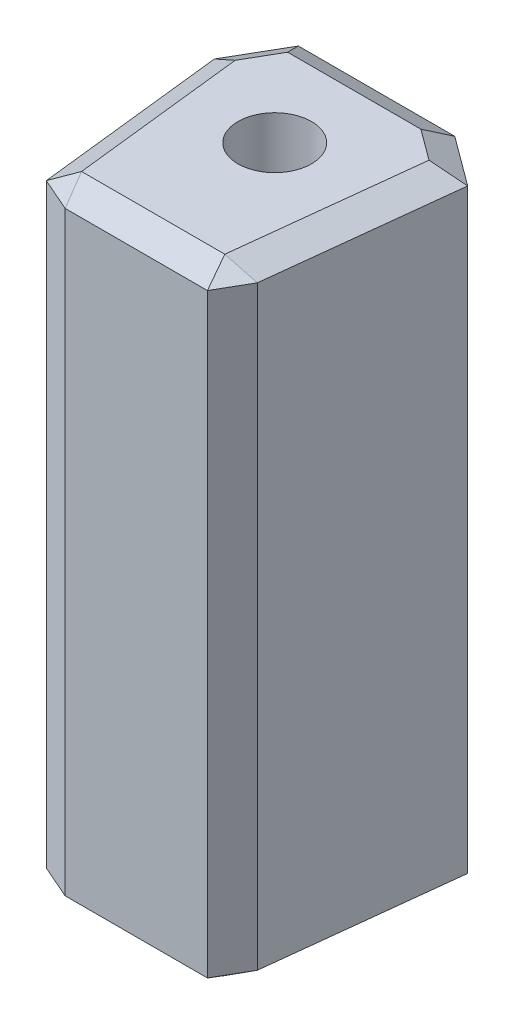
from build123d import *
from OCP.BRepFilletAPI import BRepFilletAPI_MakeChamfer

# Parameters (mm, degrees)
SKETCH1_R           = 3.175
BOSS_EXTRUDE1_DEPTH = 53.975
CHAMFER1_SIZE       = 3.175
CHAMFER1_SIZE2      = 4.631063529
CHAMFER2_SIZE       = 1.27
CHAMFER2_SIZE2      = 2.749716278
CHAMFER2_SIZE2_2    = 2.199704526


# Read off the part's stored shape, not the designer's step: Imported1
with BuildPart() as part:
    # Sketch1 → Boss-Extrude1 (new body)
    with BuildSketch(Plane(origin=(0, -26.9875, 0), x_dir=(-1, 0, 0), z_dir=(0, -1, 0))):
        Polygon((-8.155551794, -74.05198332), (8.155551794, -74.05198332), (10.657362253, -51.82698332), (-10.657362253, -51.82698332), align=None)
        with Locations(Location((0, -61.35198332, 0), (0, 0, 270))):
            Circle(SKETCH1_R, mode=Mode.SUBTRACT)
    extrude(amount=-BOSS_EXTRUDE1_DEPTH)

    # Chamfer1: one chamfer whose edges measure the first distance from different faces: ONE call of the kernel's chamfer builder (chamfer() names one face for all edges)
    chamfer1_edges_1 = [part.edges().sort_by_distance(p)[0] for p in [
        (-10.657362253, 0, 51.82698332),
    ]]
    chamfer1_side_1 = [part.faces().sort_by_distance(p)[0] for p in [
        (0, 0, 51.82698332),
    ]]
    chamfer1_edges_2 = [part.edges().sort_by_distance(p)[0] for p in [
        (10.657362253, 0, 51.82698332),
    ]]
    chamfer1_side_2 = [part.faces().sort_by_distance(p)[0] for p in [
        (9.406457023, 0, 62.93948332),
    ]]
    chamfer1 = BRepFilletAPI_MakeChamfer(part.part.solid().wrapped)
    for e in chamfer1_edges_1:
        chamfer1.Add(CHAMFER1_SIZE, CHAMFER1_SIZE2, e.wrapped, chamfer1_side_1[0].wrapped)  # the first distance lies on this face
    for e in chamfer1_edges_2:
        chamfer1.Add(CHAMFER1_SIZE, CHAMFER1_SIZE2, e.wrapped, chamfer1_side_2[0].wrapped)  # the first distance lies on this face
    add(Compound.cast(chamfer1.Shape()), mode=Mode.REPLACE)

    # Chamfer2: one chamfer whose edges measure the first distance from different faces: ONE call of the kernel's chamfer builder (chamfer() names one face for all edges)
    chamfer2_edges_1 = [part.edges().sort_by_distance(p)[0] for p in [
        (8.155551794, 0, 74.05198332),
    ]]
    chamfer2_side_1 = [part.faces().sort_by_distance(p)[0] for p in [
        (0, 0, 74.05198332),
    ]]
    chamfer2_edges_2 = [part.edges().sort_by_distance(p)[0] for p in [
        (-9.147439527, -26.9875, 65.240482514),
        (-9.147439527, 26.9875, 65.240482514),
    ]]
    chamfer2_side_2 = [part.faces().sort_by_distance(p)[0] for p in [
        (-9.147439527, 0, 65.240482514),
    ]]
    chamfer2_edges_3 = [part.edges().sort_by_distance(p)[0] for p in [
        (0, -26.9875, 74.05198332),
        (0, 26.9875, 74.05198332),
    ]]
    chamfer2_side_3 = [part.faces().sort_by_distance(p)[0] for p in [
        (0, 0, 74.05198332),
    ]]
    chamfer2_edges_4 = [part.edges().sort_by_distance(p)[0] for p in [
        (9.228877825, 26.9875, 64.517019969),
        (9.228877825, -26.9875, 64.517019969),
    ]]
    chamfer2_side_4 = [part.faces().sort_by_distance(p)[0] for p in [
        (9.228877825, 0, 64.517019969),
    ]]
    chamfer2_edges_5 = [part.edges().sort_by_distance(p)[0] for p in [
        (-8.155551794, 0, 74.05198332),
    ]]
    chamfer2_side_5 = [part.faces().sort_by_distance(p)[0] for p in [
        (-9.147439527, 0, 65.240482514),
    ]]
    chamfer2_edges_6 = [part.edges().sort_by_distance(p)[0] for p in [
        (-0.728031765, -26.9875, 51.82698332),
        (-0.728031765, 26.9875, 51.82698332),
    ]]
    chamfer2_side_6 = [part.faces().sort_by_distance(p)[0] for p in [
        (-0.728031765, 0, 51.82698332),
    ]]
    chamfer2_edges_7 = [part.edges().sort_by_distance(p)[0] for p in [
        (8.16425129, -26.9875, 53.404519969),
        (8.16425129, 26.9875, 53.404519969),
    ]]
    chamfer2_side_7 = [part.faces().sort_by_distance(p)[0] for p in [
        (8.16425129, 0, 53.404519969),
    ]]
    chamfer2_edges_8 = [part.edges().sort_by_distance(p)[0] for p in [
        (-8.810844757, -26.9875, 54.127982514),
        (-8.810844757, 26.9875, 54.127982514),
    ]]
    chamfer2_side_8 = [part.faces().sort_by_distance(p)[0] for p in [
        (-8.810844757, 0, 54.127982514),
    ]]
    chamfer2 = BRepFilletAPI_MakeChamfer(part.part.solid().wrapped)
    for e in chamfer2_edges_1:
        chamfer2.Add(CHAMFER2_SIZE, CHAMFER2_SIZE2, e.wrapped, chamfer2_side_1[0].wrapped)  # the first distance lies on this face
    for e in chamfer2_edges_2:
        chamfer2.Add(CHAMFER2_SIZE, CHAMFER2_SIZE2_2, e.wrapped, chamfer2_side_2[0].wrapped)  # the first distance lies on this face
    for e in chamfer2_edges_3:
        chamfer2.Add(CHAMFER2_SIZE, CHAMFER2_SIZE2_2, e.wrapped, chamfer2_side_3[0].wrapped)  # the first distance lies on this face
    for e in chamfer2_edges_4:
        chamfer2.Add(CHAMFER2_SIZE, CHAMFER2_SIZE2_2, e.wrapped, chamfer2_side_4[0].wrapped)  # the first distance lies on this face
    for e in chamfer2_edges_5:
        chamfer2.Add(CHAMFER2_SIZE, CHAMFER2_SIZE2, e.wrapped, chamfer2_side_5[0].wrapped)  # the first distance lies on this face
    for e in chamfer2_edges_6:
        chamfer2.Add(CHAMFER2_SIZE, CHAMFER2_SIZE2_2, e.wrapped, chamfer2_side_6[0].wrapped)  # the first distance lies on this face
    for e in chamfer2_edges_7:
        chamfer2.Add(CHAMFER2_SIZE, CHAMFER2_SIZE2_2, e.wrapped, chamfer2_side_7[0].wrapped)  # the first distance lies on this face
    for e in chamfer2_edges_8:
        chamfer2.Add(CHAMFER2_SIZE, CHAMFER2_SIZE2_2, e.wrapped, chamfer2_side_8[0].wrapped)  # the first distance lies on this face
    add(Compound.cast(chamfer2.Shape()), mode=Mode.REPLACE)


solid = part.part
